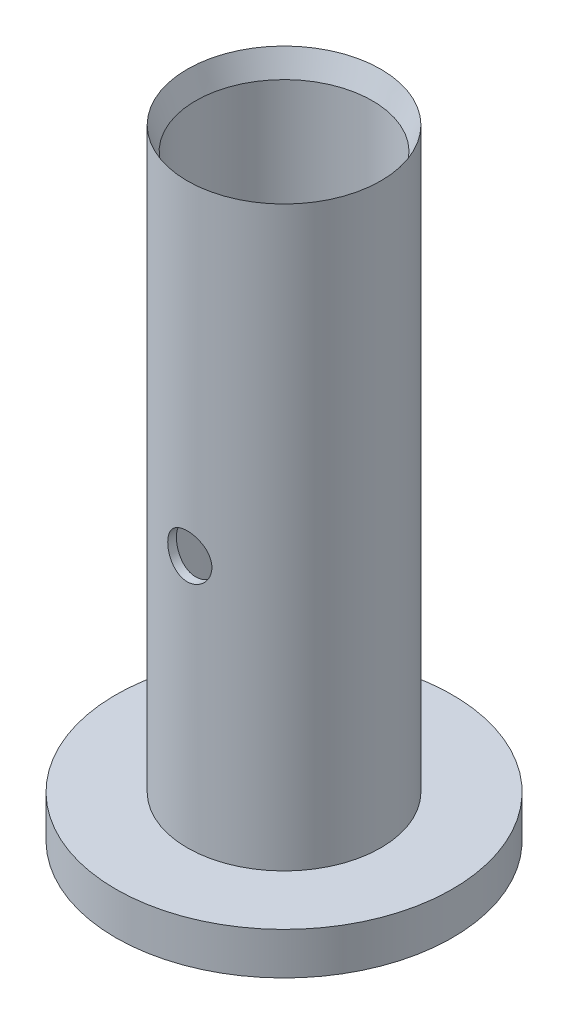
from build123d import *

# Parameters (mm, degrees)
SKETCH1_R           = 20
BOSS_EXTRUDE1_DEPTH = 5
SKETCH2_R           = 11.5
SKETCH2_R_2         = 10.5
BOSS_EXTRUDE2_DEPTH = 70
SKETCH3_R           = 2.625
CUT_EXTRUDE1_DEPTH  = 81.156097709
CHAMFER1_SIZE       = 1.5
CHAMFER1_SIZE_2     = 4.121216129


with BuildPart() as part:
    # Sketch1 → Boss-Extrude1 (new body)
    with BuildSketch(Plane(origin=(0, 0, 0), x_dir=(1, 0, 0), z_dir=(0, 1, 0))):
        with Locations(Location((0, 0, 0), (0, 0, 270))):
            Circle(SKETCH1_R)
    extrude(amount=BOSS_EXTRUDE1_DEPTH)

    # Sketch2 → Boss-Extrude2 (add)
    with BuildSketch(Plane(origin=(0, 5, 0), x_dir=(1, 0, 0), z_dir=(0, 1, 0))):
        with Locations(Location((0, 0, 0), (0, 0, 270))):
            Circle(SKETCH2_R)
        with Locations(Location((0, 0, 0), (0, 0, 270))):
            Circle(SKETCH2_R_2, mode=Mode.SUBTRACT)
    extrude(amount=BOSS_EXTRUDE2_DEPTH)

    # Sketch3 → Cut-Extrude1 (cut, through all)
    with BuildSketch(Plane.XY):
        with Locations(Location((0, 35, 0), (0, 0, 180))):
            Circle(SKETCH3_R)
    extrude(amount=CUT_EXTRUDE1_DEPTH, mode=Mode.SUBTRACT)

    # Chamfer1
    # the kernel refuses this chamfer: 4.121216129, 1.5 mm, written as the material it takes off along each edge
    with BuildSketch(Plane(origin=(0, 75, 0), x_dir=(0, 0, 1), z_dir=(-1, 0, 0))) as chamfer1_piece_1:
        Polygon((10.5 + CHAMFER1_SIZE, 0), (10.5, -CHAMFER1_SIZE_2), (10.5, 0), align=None)
    revolve(axis=Axis((0, 75, 0), (0, 1, 0)), mode=Mode.SUBTRACT)


solid = part.part
